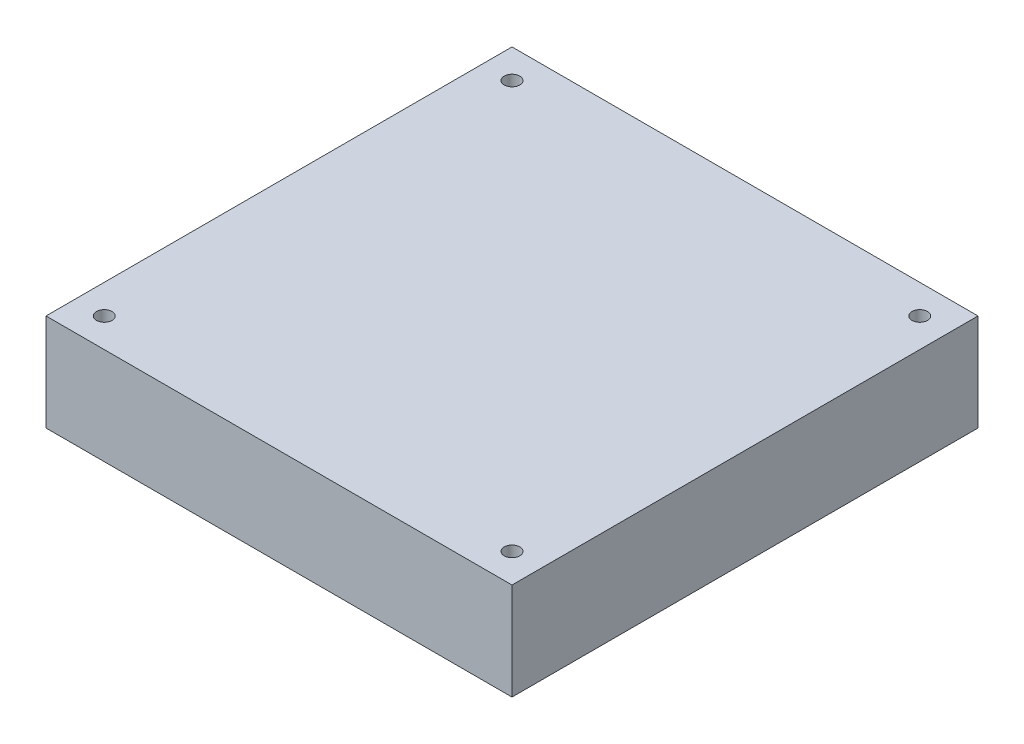
from build123d import *

# Parameters (mm, degrees)
SKETCH1_W           = 120
SKETCH1_H           = 120
BOSS_EXTRUDE1_DEPTH = 25
SKETCH2_R           = 2
CUT_EXTRUDE1_DEPTH  = 172.537167984


with BuildPart() as part:
    # Sketch1 → Boss-Extrude1 (new body)
    with BuildSketch(Plane(origin=(0, 0, 0), x_dir=(1, 0, 0), z_dir=(0, 1, 0))):
        with Locations((60, -60)):
            Rectangle(SKETCH1_W, SKETCH1_H)
    extrude(amount=BOSS_EXTRUDE1_DEPTH)

    # Sketch2 → Cut-Extrude1 (cut, through all)
    with BuildSketch(Plane(origin=(0, 25, 0), x_dir=(1, 0, 0), z_dir=(0, 1, 0))):
        with Locations((7.5, -112.5)):
            Circle(SKETCH2_R)
        with Locations((112.5, -112.5)):
            Circle(SKETCH2_R)
        with Locations((112.5, -7.5)):
            Circle(SKETCH2_R)
        with Locations((7.5, -7.5)):
            Circle(SKETCH2_R)
    extrude(amount=-CUT_EXTRUDE1_DEPTH, mode=Mode.SUBTRACT)


solid = part.part
